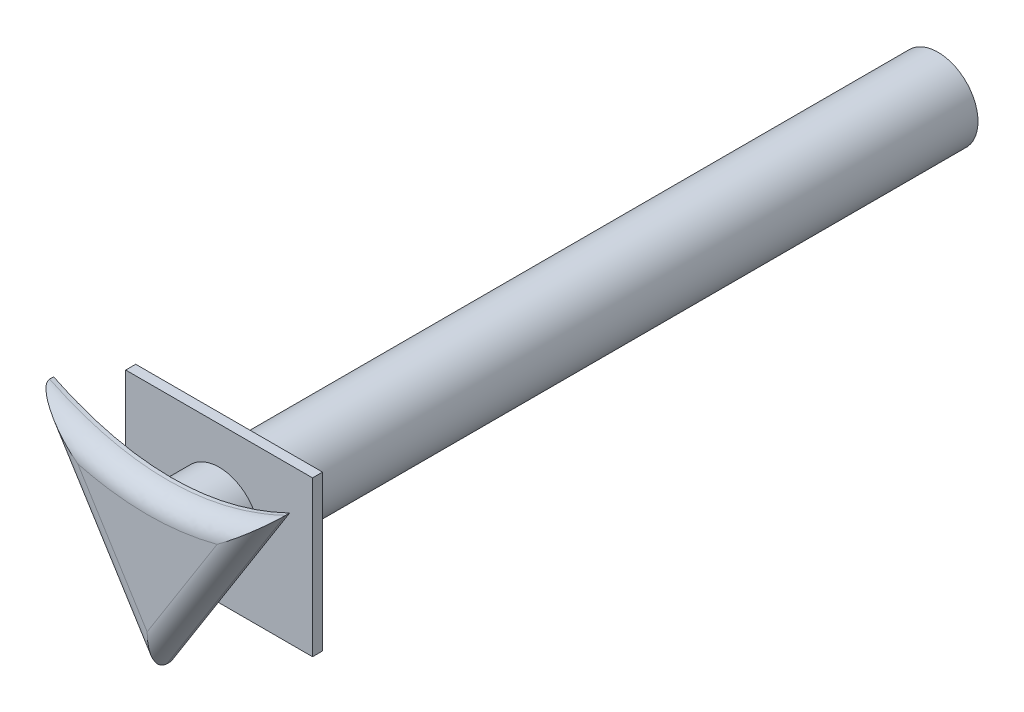
from build123d import *

# Parameters (mm, degrees)
BOSS_EXTRUDE1_DEPTH      = 0.5
BOSS_EXTRUDE1_DEPTH_BACK = 38
SKETCH1_R                = 2
BOSS_EXTRUDE2_DEPTH      = 1
BOSS_EXTRUDE2_DEPTH_BACK = 0.2
FILLET1_R                = 1
SKETCH3_W                = 9.33031097
SKETCH3_H                = 7.737675748
BOSS_EXTRUDE3_DEPTH      = 0.5


with BuildPart() as part:
    # Sketch1 → Boss-Extrude1 (new, two sides: drawn at the far end of the back side and taken through both)
    with BuildSketch(Plane.XY.offset(-BOSS_EXTRUDE1_DEPTH_BACK)):
        with Locations((36.163012657, 38.866961635)):
            Circle(SKETCH1_R)
    extrude(amount=BOSS_EXTRUDE1_DEPTH + BOSS_EXTRUDE1_DEPTH_BACK)

    # Sketch2 → Boss-Extrude2 (add, two sides: drawn at the far end of the back side and taken through both)
    with BuildSketch(Plane.XY.offset(0.5).offset(-BOSS_EXTRUDE2_DEPTH_BACK)):
        with BuildLine():
            Line((36.163012657, 33.665102482), (42.084431795, 43.04323939))
            add(Edge.make_bspline(
                [(42.084431795, 43.04323939), (36.188063939, 40.196898594), (30.297901751, 43.04323939)],
                knots=[0, 0, 0, 1, 1, 1], degree=2))
            Line((30.297901751, 43.04323939), (36.163012657, 33.665102482))
        make_face()
    extrude(amount=BOSS_EXTRUDE2_DEPTH + BOSS_EXTRUDE2_DEPTH_BACK)

    # Fillet1
    fillet1_edges = [part.edges().sort_by_distance(p)[0] for p in [
        (33.230457204, 38.354170936, 1.5),
        (39.123722226, 38.354170936, 1.5),
        (36.189615356, 41.620068992, 1.5),
    ]]
    fillet(fillet1_edges, radius=FILLET1_R - 0.0001)  # a hair under: the kernel refuses the full size

    # Sketch3 → Boss-Extrude3 (add)
    with BuildSketch(Plane.XY.offset(-2.1)):
        with Locations((36.163012657, 38.866961635)):
            Rectangle(SKETCH3_W, SKETCH3_H)
    extrude(amount=-BOSS_EXTRUDE3_DEPTH)


solid = part.part
